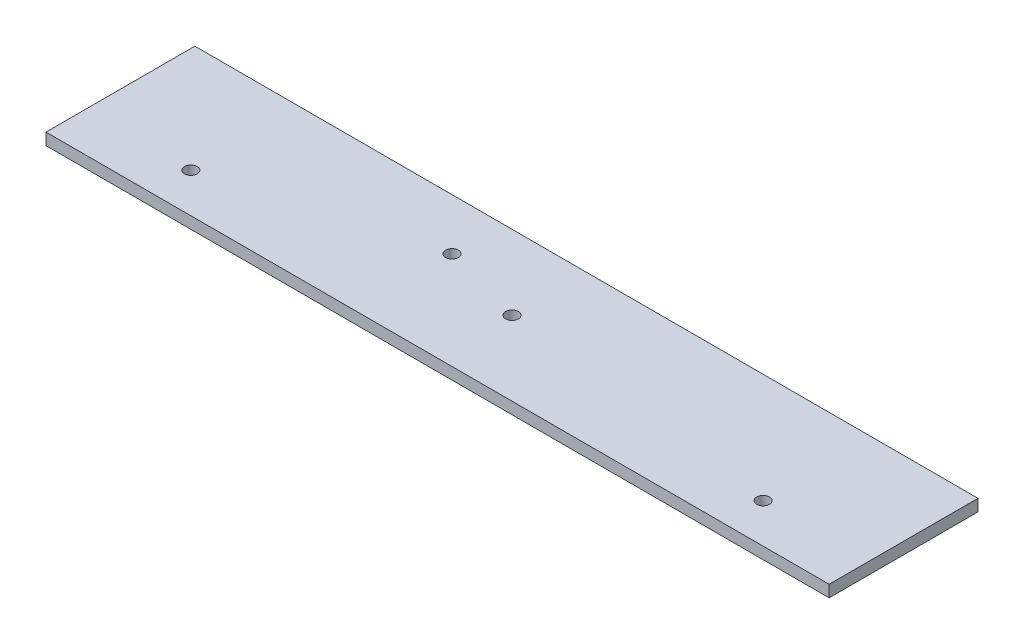
from build123d import *

# Parameters (mm, degrees)
SKETCH1_W           = 194.300874916
SKETCH1_H           = 36.931173376
SKETCH1_R           = 1.5875
BOSS_EXTRUDE1_DEPTH = 1.4605


with BuildPart() as part:
    # Sketch1 → Boss-Extrude1 (new, symmetric)
    with BuildSketch(Plane(origin=(0, 0, 0), x_dir=(1, 0, 0), z_dir=(0, 1, 0))):
        Rectangle(SKETCH1_W, SKETCH1_H)
        with Locations((-71, -8.695)):
            Circle(SKETCH1_R, mode=Mode.SUBTRACT)
        with Locations((71, -8.695)):
            Circle(SKETCH1_R, mode=Mode.SUBTRACT)
        Circle(SKETCH1_R, mode=Mode.SUBTRACT)
        with Locations((-20.62, 5.75)):
            Circle(SKETCH1_R, mode=Mode.SUBTRACT)
    extrude(amount=BOSS_EXTRUDE1_DEPTH, both=True)


solid = part.part
